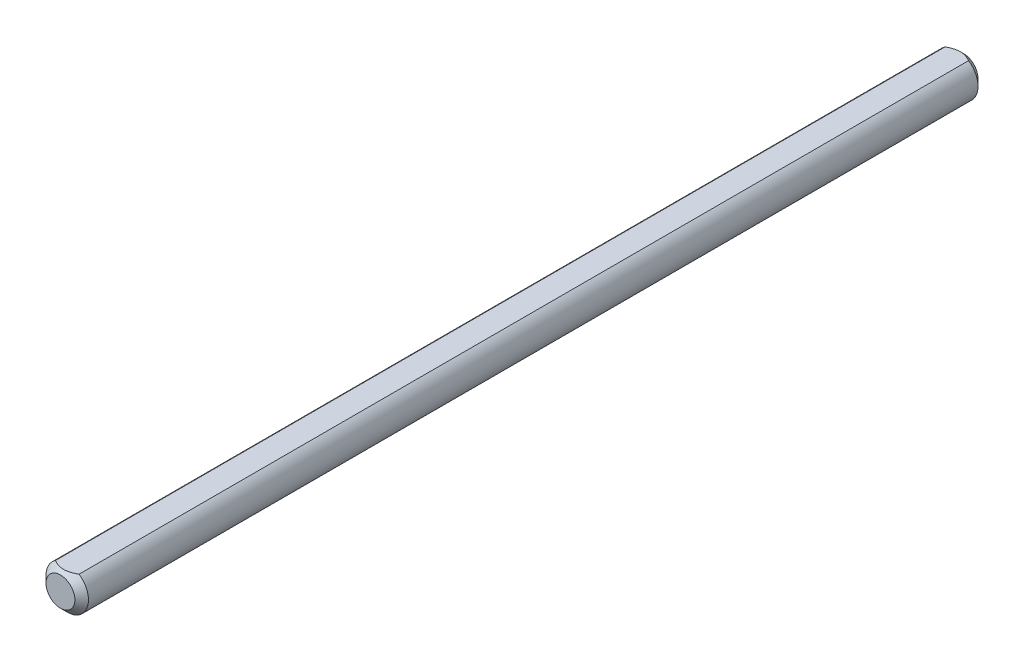
from build123d import *

# Parameters (mm, degrees)
BOSS_EXTRUDE1_DEPTH = 50


with BuildPart() as part:
    # Sketch1 → Boss-Extrude1 (new, symmetric)
    with BuildSketch(Plane.XY):
        with BuildLine():
            Line((-1.311487705, 1.95), (1.311487705, 1.95))
            ThreePointArc((1.311487705, 1.95), (0, -2.35), (-1.311487705, 1.95))
        make_face()
    extrude(amount=BOSS_EXTRUDE1_DEPTH, both=True)

    # Chamfer1: read off the stored shape, not the designer's step
    # Chamfer1 outline → Chamfer1 (revolve, cut)
    with BuildSketch(Plane.XZ):
        Polygon((2.35, -49.25), (1.6, -50), (2.35, -50), align=None)
        Polygon((1.6, 50), (2.35, 49.25), (2.35, 50), align=None)
    revolve(axis=Axis((0, 0, 0), (0, 0, 1)), mode=Mode.SUBTRACT)


solid = part.part
